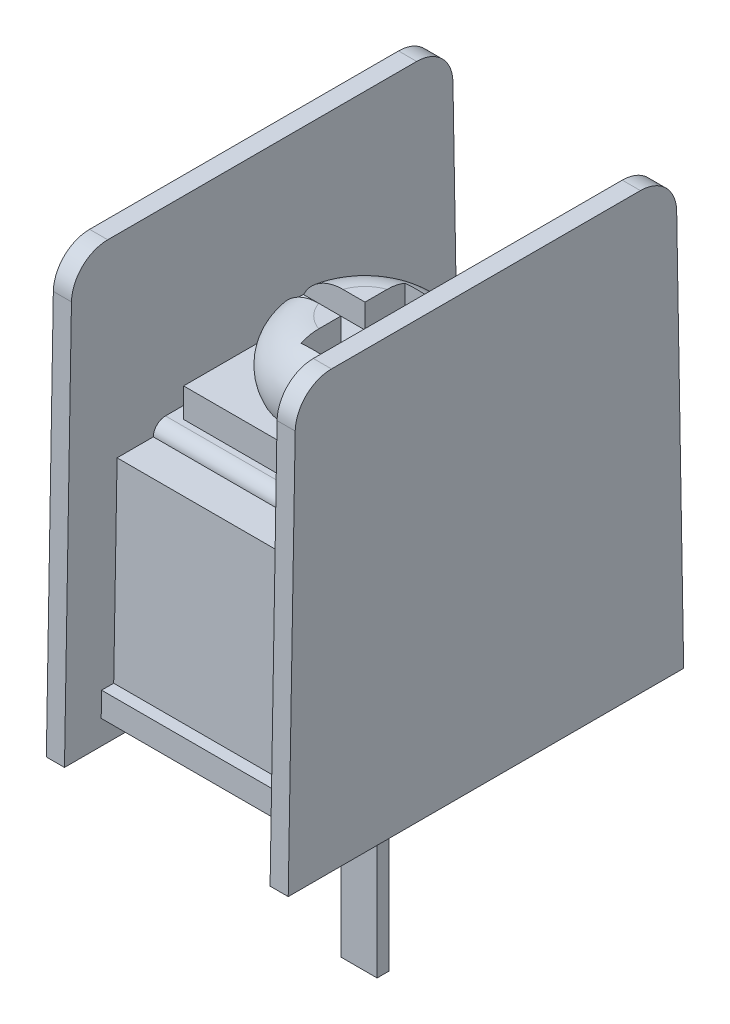
from build123d import *

# Parameters (mm, degrees)
SKETCH_1_W          = 10
SKETCH_1_H          = 16
EXTRUDE_1_DEPTH     = 18
SKETCH_2_W          = 8.5
SKETCH_2_H          = 16
CUT_EXTRUDE_1_DEPTH = 8
SKETCH_5_W          = 8.5
SKETCH_5_H          = 8
CUT_EXTRUDE_4_DEPTH = 2
SKETCH_6_W          = 8.5
SKETCH_6_H          = 2
CUT_EXTRUDE_5_DEPTH = 1.5
DRAFT_1_ANGLE       = 1
SKETCH_7_W          = 8.5
SKETCH_7_H          = 13.349101298
CUT_EXTRUDE_6_DEPTH = 1
FILLET_1_R          = 1.5
SKETCH_8_W          = 8.5
SKETCH_8_H          = 9
EXTRUDE_2_DEPTH     = 0.5
SKETCH_9_W          = 1.5
SKETCH_9_H          = 0.5
EXTRUDE_3_DEPTH     = 10
FILLET_2_R          = 0.5
SKETCH_10_W         = 7.5
SKETCH_10_H         = 7.5
EXTRUDE_4_DEPTH     = 1.2
CUT_EXTRUDE_7_DEPTH = 1


with BuildPart() as part:
    # 草图1 → 拉伸1 (new body)
    with BuildSketch(Plane(origin=(0, 0, 0), x_dir=(1, 0, 0), z_dir=(0, 1, 0))):
        Rectangle(SKETCH_1_W, SKETCH_1_H)
    extrude(amount=EXTRUDE_1_DEPTH)

    # 草图2 → 切除-拉伸1 (cut)
    with BuildSketch(Plane(origin=(0, 18, 0), x_dir=(-1, 0, 0), z_dir=(0, 1, 0))):
        Rectangle(SKETCH_2_W, SKETCH_2_H)
    extrude(amount=-CUT_EXTRUDE_1_DEPTH, mode=Mode.SUBTRACT)

    # 草图5 → 切除-拉伸4 (cut)
    with BuildSketch(Plane(origin=(0, 0, -8), x_dir=(-1, 0, 0), z_dir=(0, 0, -1))):
        with Locations((0, 6)):
            Rectangle(SKETCH_5_W, SKETCH_5_H)
    cut_extrude_4 = extrude(amount=-CUT_EXTRUDE_4_DEPTH, mode=Mode.SUBTRACT)

    # 草图6 → 切除-拉伸5 (cut)
    with BuildSketch(Plane(origin=(0, 0, -8), x_dir=(-1, 0, 0), z_dir=(0, 0, -1))):
        with Locations((0, 1)):
            Rectangle(SKETCH_6_W, SKETCH_6_H)
    cut_extrude_5 = extrude(amount=-CUT_EXTRUDE_5_DEPTH, mode=Mode.SUBTRACT)

    # 镜向3: 切除-拉伸4, 切除-拉伸5 across plane
    add(cut_extrude_4.mirror(Plane.XY), mode=Mode.SUBTRACT)
    add(cut_extrude_5.mirror(Plane.XY), mode=Mode.SUBTRACT)

    # 拔模1
    draft_1_faces = [part.faces().sort_by_distance(p)[0] for p in [
        (4.625, 9, 8),
        (-4.625, 9, 8),
        (0, 1, 6.5),
        (0, 6, 6),
        (0, 1, -6.5),
        (-4.625, 9, -8),
        (0, 6, -6),
        (4.625, 9, -8),
    ]]
    draft(draft_1_faces, Plane(origin=(4.25, 10, -8), x_dir=(0, 0, 1), z_dir=(0, 1, 0)), DRAFT_1_ANGLE)

    # 草图7 → 切除-拉伸6 (cut)
    with BuildSketch(Plane.XZ):
        Rectangle(SKETCH_7_W, SKETCH_7_H)
    extrude(amount=-CUT_EXTRUDE_6_DEPTH, mode=Mode.SUBTRACT)

    # 圆角1
    fillet_1_edges = [part.edges().sort_by_distance(p)[0] for p in [
        (4.625, 18, -7.860359481),
        (4.625, 18, 7.860359481),
        (-4.625, 18, -7.860359481),
        (-4.625, 18, 7.860359481),
    ]]
    fillet(fillet_1_edges, radius=FILLET_1_R)

    # 草图8 → 拉伸2 (add)
    with BuildSketch(Plane(origin=(0, 10, 0), x_dir=(-1, 0, 0), z_dir=(0, 1, 0))):
        Rectangle(SKETCH_8_W, SKETCH_8_H)
    extrude(amount=EXTRUDE_2_DEPTH)

    # 草图9 → 拉伸3 (add)
    with BuildSketch(Plane.XZ.offset(-1)):
        Rectangle(SKETCH_9_W, SKETCH_9_H)
    extrude(amount=EXTRUDE_3_DEPTH)

    # 圆角2
    fillet_2_edges = [part.edges().sort_by_distance(p)[0] for p in [
        (0, 10.5, -4.5),
        (0, 10.5, 4.5),
    ]]
    fillet(fillet_2_edges, radius=FILLET_2_R - 0.0001)  # a hair under: the kernel refuses the full size

    # 草图10 → 拉伸4 (add)
    with BuildSketch(Plane(origin=(0, 10.5, 0), x_dir=(-1, 0, 0), z_dir=(0, 1, 0))):
        Rectangle(SKETCH_10_W, SKETCH_10_H)
    extrude(amount=EXTRUDE_4_DEPTH)

    # 草图11 → 旋转1 (revolve)
    with BuildSketch(Plane.XY):
        with BuildLine():
            Line((0, 11.7), (0, 14.2))
            Line((0, 14.2), (1.5, 14.2))
            ThreePointArc((1.5, 14.2), (2.979019946, 13.385414347), (3.08113883, 11.7))
            Line((3.08113883, 11.7), (0, 11.7))
        make_face()
    revolve(axis=Axis((0, 11.7, 0), (0, 1, 0)))

    # 草图12 → 切除-拉伸7 (cut)
    with BuildSketch(Plane(origin=(0, 14.2, 0), x_dir=(1, 0, 0), z_dir=(0, 1, 0))):
        Polygon((-3.75, 0.5), (-0.5, 0.5), (-0.5, 2.15), (0.5, 2.15), (0.5, 0.5), (3.75, 0.5), (3.75, -0.5), (0.5, -0.5), (0.5, -2.15), (-0.5, -2.15), (-0.5, -0.5), (-3.75, -0.5), align=None)
    extrude(amount=-CUT_EXTRUDE_7_DEPTH, mode=Mode.SUBTRACT)


solid = part.part
